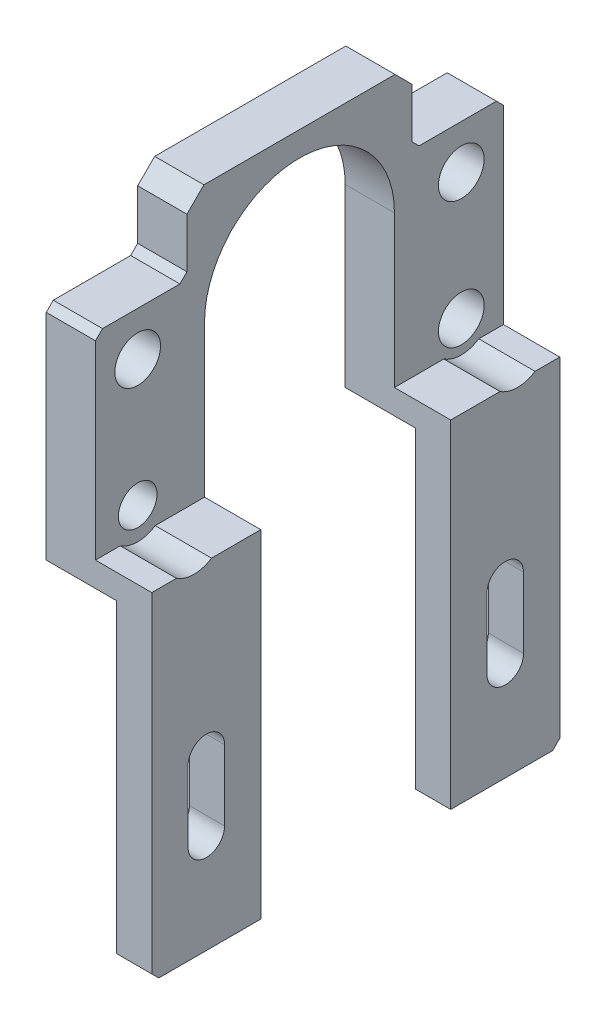
from build123d import *

# Parameters (mm, degrees)
SKETCH1_W                               = 43
SKETCH1_H                               = 60
BOSS_EXTRUDE1_DEPTH                     = 20
SKETCH2_W                               = 13
SKETCH2_H                               = 10.5
CUT_EXTRUDE1_DEPTH                      = 44.874821937
SKETCH3_W                               = 13
SKETCH3_H                               = 10.5
CUT_EXTRUDE2_DEPTH                      = 44.874821937
F_5_5_5_5_DIAMETER_HOLE1_D              = 5.5
M22_CLEARANCE_HOLE1_D                   = 26
F_5_5_5_5_DIAMETER_HOLE2_D              = 5.5
F_5_5_5_5_DIAMETER_HOLE2_DEPTH          = 30
CBORE_FOR_M5_HEX_HEAD_BOLT1_D           = 5.5
CBORE_FOR_M5_HEX_HEAD_BOLT1_DEPTH       = 39.75
CBORE_FOR_M5_HEX_HEAD_BOLT1_CBORE_D     = 10.8
CBORE_FOR_M5_HEX_HEAD_BOLT1_CBORE_DEPTH = 3
CHAMFER1_SIZE                           = 3
CHAMFER2_SIZE                           = 0.5
CHAMFER3_SIZE                           = 1
BOSS_EXTRUDE2_OUTLINE_R                 = 2.75
BOSS_EXTRUDE2_OUTLINE_R_2               = 3.25
BOSS_EXTRUDE2_OUTLINE_R_3               = 13.5
BOSS_EXTRUDE2_DEPTH                     = 15
CUT_EXTRUDE4_DEPTH                      = 15
CHAMFER4_SIZE                           = 1
CUT_EXTRUDE5_DEPTH                      = 94.296851501
CUT_EXTRUDE5_DEPTH_BACK                 = 94.296851501
SKETCH17_W                              = 10
SKETCH17_H                              = 43.45
SKETCH17_H_2                            = 1
CUT_EXTRUDE6_DEPTH                      = 77.741791092
SKETCH20_R                              = 13.5
SKETCH20_W                              = 27
SKETCH20_H                              = 44.45
CUT_EXTRUDE7_DEPTH                      = 77.741791092
SKETCH22_W                              = 8
SKETCH22_H                              = 58
CUT_EXTRUDE8_DEPTH                      = 38.5
SKETCH23_R                              = 4.5
CUT_EXTRUDE9_DEPTH                      = 76.68555014


# Read off the part's stored shape, not the designer's step: Boss-Extrude2
with BuildPart() as part:
    # Sketch1 → Boss-Extrude1 (new body)
    with BuildSketch(Plane(origin=(-20, 0, 0), x_dir=(0, -1, 0), z_dir=(-1, 0, 0))):
        with Locations((3.5, 0)):
            Rectangle(SKETCH1_W, SKETCH1_H)
    extrude(amount=-BOSS_EXTRUDE1_DEPTH)

    # Sketch2 → Cut-Extrude1 (cut, through all)
    with BuildSketch(Plane(origin=(0, 0, 0), x_dir=(0, 0, -1), z_dir=(1, 0, 0))):
        with Locations((-23.5, 12.75)):
            Rectangle(SKETCH2_W, SKETCH2_H)
    extrude(amount=-CUT_EXTRUDE1_DEPTH, mode=Mode.SUBTRACT)

    # Sketch3 → Cut-Extrude2 (cut, through all)
    with BuildSketch(Plane(origin=(0, 0, 0), x_dir=(0, 0, -1), z_dir=(1, 0, 0))):
        with Locations((23.5, 12.75)):
            Rectangle(SKETCH3_W, SKETCH3_H)
    extrude(amount=-CUT_EXTRUDE2_DEPTH, mode=Mode.SUBTRACT)

    # Ø5.5 (5.5) Diameter Hole1 (through all)
    with Locations(Plane.ZY.offset(20)):
        with Locations((23, 0.25), (-23, -17.75), (-23, 0.25)):
            Hole(F_5_5_5_5_DIAMETER_HOLE1_D / 2)

    # M22 Clearance Hole1 (through all)
    with Locations(Plane(origin=(0, 0, 0), x_dir=(0, 0, -1), z_dir=(1, 0, 0))):
        with Locations((0, 0)):
            Hole(M22_CLEARANCE_HOLE1_D / 2)

    # Ø5.5 (5.5) Diameter Hole2
    with Locations(Plane(origin=(0, 0, 0), x_dir=(0, 0, -1), z_dir=(1, 0, 0))):
        with Locations((-23, -17.75)):
            Hole(F_5_5_5_5_DIAMETER_HOLE2_D / 2, depth=F_5_5_5_5_DIAMETER_HOLE2_DEPTH)

    # CBORE for M5 Hex Head Bolt1
    with Locations(Plane(origin=(0, 7.5, 0), x_dir=(1, 0, 0), z_dir=(0, 1, 0))):
        with Locations((-10, 23), (-10, -23)):
            CounterBoreHole(CBORE_FOR_M5_HEX_HEAD_BOLT1_D / 2, CBORE_FOR_M5_HEX_HEAD_BOLT1_CBORE_D / 2, CBORE_FOR_M5_HEX_HEAD_BOLT1_CBORE_DEPTH, depth=CBORE_FOR_M5_HEX_HEAD_BOLT1_DEPTH)

    # Chamfer1
    chamfer1_edges = [part.edges().sort_by_distance(p)[0] for p in [
        (-10, 18, 17),
        (-10, 18, -17),
    ]]
    chamfer(chamfer1_edges, length=CHAMFER1_SIZE)

    # Chamfer2
    chamfer2_edges = [part.edges().sort_by_distance(p)[0] for p in [
        (-7.25, -25, -23),
        (-20, 0.25, -20.25),
        (0, 0.25, -20.25),
        (-20, -17.75, -20.25),
        (0, -17.75, -20.25),
        (-20, 0.25, 25.75),
        (0, 0.25, 25.75),
        (0, 0, -13),
        (-20, 0, -13),
        (-20, -17.75, 20.25),
        (0, -17.75, 20.25),
        (-7.25, -25, 23),
    ]]
    chamfer(chamfer2_edges, length=CHAMFER2_SIZE)

    # Chamfer3
    chamfer3_edges = [part.edges().sort_by_distance(p)[0] for p in [
        (0, 11.25, -17),
        (-20, 11.25, -17),
        (0, 18, 0),
        (0, 16.5, 15.5),
        (0, 16.5, -15.5),
        (-20, 18, 0),
        (-20, 16.5, 15.5),
        (-20, 16.5, -15.5),
        (-10, 7.5, 30),
        (-20, 11.25, 17),
        (-20, 7.5, 23.5),
        (0, 7.5, 23.5),
        (0, 11.25, 17),
        (-20, -8.75, -30),
        (0, -8.75, -30),
        (-20, 7.5, -23.5),
        (-10, 7.5, -30),
        (0, 7.5, -23.5),
        (0, -25, 0),
        (-20, -8.75, 30),
        (-20, -25, 0),
        (-10, -25, -30),
        (-10, -25, 30),
        (0, -8.75, 30),
    ]]
    chamfer(chamfer3_edges, length=CHAMFER3_SIZE)

    # Boss-Extrude2 outline → Boss-Extrude2 (add)
    with BuildSketch(Plane(origin=(0, 0, 0), x_dir=(0, 0, -1), z_dir=(1, 0, 0))):
        Polygon((-29, 6.5), (-29, -69.45), (29, -69.45), (29, 6.5), (16, 6.5), (16, 14.585786438), (13.585786438, 17), (-13.585786438, 17), (-16, 14.585786438), (-16, 6.5), align=None)
        with Locations((-23, -17.75)):
            Circle(BOSS_EXTRUDE2_OUTLINE_R, mode=Mode.SUBTRACT)
        with Locations((-23, 0.25)):
            Circle(BOSS_EXTRUDE2_OUTLINE_R_2, mode=Mode.SUBTRACT)
        with Locations((23, -17.75)):
            Circle(BOSS_EXTRUDE2_OUTLINE_R_2, mode=Mode.SUBTRACT)
        Circle(BOSS_EXTRUDE2_OUTLINE_R_3, mode=Mode.SUBTRACT)
        with Locations((23, 0.25)):
            Circle(BOSS_EXTRUDE2_OUTLINE_R_2, mode=Mode.SUBTRACT)
    extrude(amount=BOSS_EXTRUDE2_DEPTH)

    # Sketch16 → Cut-Extrude4 (cut)
    with BuildSketch(Plane(origin=(15, 0, 0), x_dir=(0, 0, -1), z_dir=(1, 0, 0))):
        with BuildLine():
            Line((-23.85, -55.4), (-23.85, -45.4))
            ThreePointArc((-23.85, -45.4), (-21.25, -42.8), (-18.65, -45.4))
            Line((-18.65, -45.4), (-18.65, -55.4))
            ThreePointArc((-18.65, -55.4), (-21.25, -58), (-23.85, -55.4))
        make_face()
        with BuildLine():
            Line((23.85, -55.4), (23.85, -45.4))
            ThreePointArc((23.85, -45.4), (21.25, -42.8), (18.65, -45.4))
            Line((18.65, -45.4), (18.65, -55.4))
            ThreePointArc((18.65, -55.4), (21.25, -58), (23.85, -55.4))
        make_face()
    extrude(amount=-CUT_EXTRUDE4_DEPTH, mode=Mode.SUBTRACT)

    # Chamfer4
    # the kernel refuses this chamfer: 1 mm, written as the material it adds along each edge
    with BuildSketch(Plane(origin=(-2.571682988, 6.5, -16), x_dir=(0, 0.9996219169112968, 0.027495876610585623), z_dir=(1, 0, 0))) as chamfer4_piece_1:
        Polygon((CHAMFER4_SIZE * 0.999621916911, -CHAMFER4_SIZE * 0.0274958766106), (-CHAMFER4_SIZE * 0.0274958766106, -CHAMFER4_SIZE * 0.999621916911), (0, 0), align=None)
    extrude(amount=17.571682988)
    with BuildSketch(Plane(origin=(-2.571682988, 6.5, 16), x_dir=(0, 0.9996219169112968, -0.027495876610585623), z_dir=(1, 0, 0))) as chamfer4_piece_2:
        Polygon((CHAMFER4_SIZE * 0.999621916911, CHAMFER4_SIZE * 0.0274958766106), (-CHAMFER4_SIZE * 0.0274958766106, CHAMFER4_SIZE * 0.999621916911), (0, 0), align=None)
    extrude(amount=17.571682988)
    # the kernel refuses this chamfer: 1 mm, written as the material it takes off along each edge
    with BuildSketch(Plane(origin=(-2.571682988, 6.5, 29), x_dir=(0, -0.9996219169112968, 0.027495876610585623), z_dir=(1, 0, 0))) as chamfer4_2_piece_1_section:
        Polygon((CHAMFER4_SIZE * 0.999621916911, CHAMFER4_SIZE * 0.0274958766106), (-CHAMFER4_SIZE * 0.0274958766106, CHAMFER4_SIZE * 0.999621916911), (0, 0), align=None)
    chamfer4_2_piece_1 = extrude(amount=20.143365976, mode=Mode.PRIVATE)
    chamfer4_2_piece_1 = split(chamfer4_2_piece_1, bisect_by=Plane(origin=(0.509665213, 6.397220748, 28.490334787), z_dir=(-0.7071067811865551, 0, -0.7071067811865401)), keep=Keep.TOP, mode=Mode.PRIVATE)
    chamfer4_2_piece_1 = split(chamfer4_2_piece_1, bisect_by=Plane(origin=(0.238407906, 6.261592094, 28.354706133), z_dir=(0.7071067811865476, 0.7071067811865475, -8.40952718991379e-15)), keep=Keep.TOP, mode=Mode.PRIVATE)
    add(chamfer4_2_piece_1, mode=Mode.SUBTRACT)
    with BuildSketch(Plane(origin=(-2.571682988, 6.5, 29), x_dir=(0, -0.9996219169112968, 0.027495876610585623), z_dir=(1, 0, 0))) as chamfer4_2_piece_2_section:
        Polygon((CHAMFER4_SIZE * 0.999621916911, CHAMFER4_SIZE * 0.0274958766106), (-CHAMFER4_SIZE * 0.0274958766106, CHAMFER4_SIZE * 0.999621916911), (0, 0), align=None)
    chamfer4_2_piece_2 = extrude(amount=20.143365976, mode=Mode.PRIVATE)
    chamfer4_2_piece_2 = split(chamfer4_2_piece_2, bisect_by=Plane(origin=(0.238407906, 5.854706133, 28.761592094), z_dir=(0.7071067811865551, 0, 0.7071067811865401)), keep=Keep.TOP, mode=Mode.PRIVATE)
    chamfer4_2_piece_2 = split(chamfer4_2_piece_2, bisect_by=Plane(origin=(0.509665213, 5.990334787, 28.897220748), z_dir=(-0.7071067811865476, -0.7071067811865475, 8.40952718991379e-15)), keep=Keep.TOP, mode=Mode.PRIVATE)
    add(chamfer4_2_piece_2, mode=Mode.SUBTRACT)
    with BuildSketch(Plane(origin=(-2.571682988, 6.5, 29), x_dir=(0, -0.9996219169112968, 0.027495876610585623), z_dir=(1, 0, 0))) as chamfer4_2_piece_3_section:
        Polygon((CHAMFER4_SIZE * 0.999621916911, CHAMFER4_SIZE * 0.0274958766106), (-CHAMFER4_SIZE * 0.0274958766106, CHAMFER4_SIZE * 0.999621916911), (0, 0), align=None)
    chamfer4_2_piece_3 = extrude(amount=20.143365976, mode=Mode.PRIVATE)
    chamfer4_2_piece_3 = split(chamfer4_2_piece_3, bisect_by=Plane(origin=(4.683816691, 6.171538214, 24.316183309), z_dir=(0.7071067811865551, 0, 0.7071067811865401)), keep=Keep.TOP, mode=Mode.PRIVATE)
    chamfer4_2_piece_3 = split(chamfer4_2_piece_3, bisect_by=Plane(origin=(4.683816691, 1.816183309, 28.671538214), z_dir=(0.7071067811865476, 0.7071067811865475, -8.40952718991379e-15)), keep=Keep.TOP, mode=Mode.PRIVATE)
    add(chamfer4_2_piece_3, mode=Mode.SUBTRACT)
    with BuildSketch(Plane(origin=(-2.571682988, -69.45, 29), x_dir=(0, 0.9996219169112968, 0.02749587661058574), z_dir=(1, 0, 0))) as chamfer4_2_piece_4:
        Polygon((CHAMFER4_SIZE * 0.999621916911, -CHAMFER4_SIZE * 0.0274958766106), (-CHAMFER4_SIZE * 0.0274958766106, -CHAMFER4_SIZE * 0.999621916911), (0, 0), align=None)
    extrude(amount=20.143365976, mode=Mode.SUBTRACT)
    with BuildSketch(Plane(origin=(-2.571682988, -69.45, -29), x_dir=(0, 0.9996219169112968, -0.02749587661058574), z_dir=(1, 0, 0))) as chamfer4_2_piece_5:
        Polygon((CHAMFER4_SIZE * 0.999621916911, CHAMFER4_SIZE * 0.0274958766106), (-CHAMFER4_SIZE * 0.0274958766106, CHAMFER4_SIZE * 0.999621916911), (0, 0), align=None)
    extrude(amount=20.143365976, mode=Mode.SUBTRACT)
    with BuildSketch(Plane(origin=(-2.571682988, 6.5, -29), x_dir=(1.2022868737477314e-14, 0.02749587661058651, 0.9996219169112968), z_dir=(1, 0, 0))) as chamfer4_2_piece_6_section:
        Polygon((CHAMFER4_SIZE * 0.999621916911, CHAMFER4_SIZE * 0.0274958766106), (-CHAMFER4_SIZE * 0.0274958766106, CHAMFER4_SIZE * 0.999621916911), (0, 0), align=None)
    chamfer4_2_piece_6 = extrude(amount=20.143365976, mode=Mode.PRIVATE)
    chamfer4_2_piece_6 = split(chamfer4_2_piece_6, bisect_by=Plane(origin=(0.509665213, 5.990334787, -28.897220748), z_dir=(-0.7071067811865476, -0.7071067811865475, 8.60574949101178e-15)), keep=Keep.TOP, mode=Mode.PRIVATE)
    chamfer4_2_piece_6 = split(chamfer4_2_piece_6, bisect_by=Plane(origin=(0.238407906, 5.854706133, -28.761592094), z_dir=(0.707106781186539, 0, -0.7071067811865561)), keep=Keep.TOP, mode=Mode.PRIVATE)
    add(chamfer4_2_piece_6, mode=Mode.SUBTRACT)
    with BuildSketch(Plane(origin=(-2.571682988, 6.5, -29), x_dir=(1.2022868737477314e-14, 0.02749587661058651, 0.9996219169112968), z_dir=(1, 0, 0))) as chamfer4_2_piece_7_section:
        Polygon((CHAMFER4_SIZE * 0.999621916911, CHAMFER4_SIZE * 0.0274958766106), (-CHAMFER4_SIZE * 0.0274958766106, CHAMFER4_SIZE * 0.999621916911), (0, 0), align=None)
    chamfer4_2_piece_7 = extrude(amount=20.143365976, mode=Mode.PRIVATE)
    chamfer4_2_piece_7 = split(chamfer4_2_piece_7, bisect_by=Plane(origin=(0.238407906, 6.261592094, -28.354706133), z_dir=(0.7071067811865476, 0.7071067811865475, -8.60574949101178e-15)), keep=Keep.TOP, mode=Mode.PRIVATE)
    chamfer4_2_piece_7 = split(chamfer4_2_piece_7, bisect_by=Plane(origin=(0.509665213, 6.397220748, -28.490334787), z_dir=(-0.707106781186539, 0, 0.7071067811865561)), keep=Keep.TOP, mode=Mode.PRIVATE)
    add(chamfer4_2_piece_7, mode=Mode.SUBTRACT)
    with BuildSketch(Plane(origin=(-2.571682988, 6.5, -29), x_dir=(1.2022868737477314e-14, 0.02749587661058651, 0.9996219169112968), z_dir=(1, 0, 0))) as chamfer4_2_piece_8_section:
        Polygon((CHAMFER4_SIZE * 0.999621916911, CHAMFER4_SIZE * 0.0274958766106), (-CHAMFER4_SIZE * 0.0274958766106, CHAMFER4_SIZE * 0.999621916911), (0, 0), align=None)
    chamfer4_2_piece_8 = extrude(amount=20.143365976, mode=Mode.PRIVATE)
    chamfer4_2_piece_8 = split(chamfer4_2_piece_8, bisect_by=Plane(origin=(4.683816691, 1.816183309, -28.671538214), z_dir=(0.7071067811865476, 0.7071067811865475, -8.60574949101178e-15)), keep=Keep.TOP, mode=Mode.PRIVATE)
    chamfer4_2_piece_8 = split(chamfer4_2_piece_8, bisect_by=Plane(origin=(4.683816691, 6.171538214, -24.316183309), z_dir=(0.707106781186539, 0, -0.7071067811865561)), keep=Keep.TOP, mode=Mode.PRIVATE)
    add(chamfer4_2_piece_8, mode=Mode.SUBTRACT)

    # Sketch17 → Cut-Extrude5 (cut, two sides: drawn at the far end of the back side and taken through both)
    with BuildSketch(Plane(origin=(0, 0, -29), x_dir=(-1, 0, 0), z_dir=(0, 0, -1)).offset(-CUT_EXTRUDE5_DEPTH_BACK)):
        Polygon((20, -25), (20, 18), (0, 18), (0, 5.5), (0, -24), (0, -25), align=None)
        with Locations((-5, -46.725)):
            Rectangle(SKETCH17_W, SKETCH17_H)
        with Locations((-5, -68.95)):
            Rectangle(SKETCH17_W, SKETCH17_H_2)
    extrude(amount=CUT_EXTRUDE5_DEPTH + CUT_EXTRUDE5_DEPTH_BACK, mode=Mode.SUBTRACT)

    # Sketch18 → Cut-Extrude6 (cut, through all)
    with BuildSketch(Plane(origin=(15, 0, 0), x_dir=(0, 0, -1), z_dir=(1, 0, 0))):
        Polygon((-29, 5.5), (-29, 6.5), (-28, 6.5), align=None)
        Polygon((28, 6.5), (29, 6.5), (29, 5.5), align=None)
    extrude(amount=-CUT_EXTRUDE6_DEPTH, mode=Mode.SUBTRACT)

    # Sketch20 → Cut-Extrude7 (cut, through all)
    with BuildSketch(Plane.ZY):
        Circle(SKETCH20_R)
        with BuildLine():
            ThreePointArc((13.5, 0), (0, -13.5), (-13.5, 0))
            Line((-13.5, 0), (-13.5, -25))
            Line((-13.5, -25), (13.5, -25))
            Line((13.5, -25), (13.5, 0))
        make_face()
        with Locations((0, -47.225)):
            Rectangle(SKETCH20_W, SKETCH20_H)
    extrude(amount=-CUT_EXTRUDE7_DEPTH, mode=Mode.SUBTRACT)

    # Sketch22 → Cut-Extrude8 (cut)
    with BuildSketch(Plane(origin=(0, 17, 0), x_dir=(1, 0, 0), z_dir=(0, 1, 0))):
        with Locations((11, 0)):
            Rectangle(SKETCH22_W, SKETCH22_H)
    extrude(amount=-CUT_EXTRUDE8_DEPTH, mode=Mode.SUBTRACT)

    # Sketch23 → Cut-Extrude9 (cut, through all)
    with BuildSketch(Plane(origin=(7, 0, 0), x_dir=(0, 0, -1), z_dir=(1, 0, 0))):
        with Locations((-23, -17.75)):
            Circle(SKETCH23_R)
        with Locations((23, -17.75)):
            Circle(SKETCH23_R)
    extrude(amount=CUT_EXTRUDE9_DEPTH, mode=Mode.SUBTRACT)


solid = part.part
